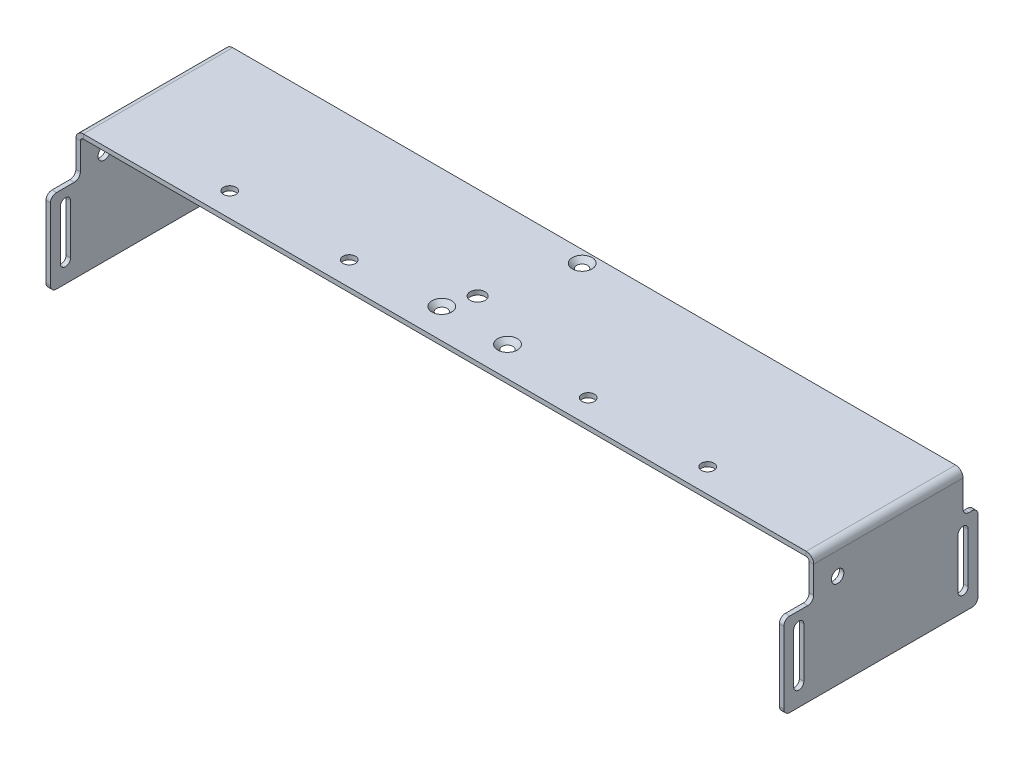
from build123d import *

# Parameters (mm, degrees)
SM_BASE_FLANGE_1_DEPTH       = 50
HOLE_WIZARD_1_AT_2_COUNT     = 2
HOLE_WIZARD_1_AT_2_PITCH     = 37.643060449
HOLE_WIZARD_1_AT_3_COUNT     = 2
HOLE_WIZARD_1_AT_3_PITCH     = 37.643060449
HOLE_WIZARD_4_2_4_2_1_D      = 4.2
HOLE_WIZARD_4_2_4_2_2_REACH  = 257.404
HOLE_WIZARD_4_2_4_2_2_BORE_R = 2.1
HOLE_WIZARD_5_0_5_1_D        = 5
SKETCH_18_W                  = 65
SKETCH_18_H                  = 28
SM_BASE_FLANGE_1_2_DEPTH     = 1.5
HOLE_START                   = -123.5
HOLE_WIZARD_3_4_3_4_2_DEPTH  = 1.5
FILLET_1_R                   = 2
FILLET_1_OF_MIRROR_2_R       = 2


# Read off the part's stored shape, not the designer's step: 基体-法兰1, Ø3.4 (3.4) 直径槽口2
# Sheet-metal steps are written as plain solids
with BuildPart() as part:
    # Sm Base Flange 1 outline → Sm Base Flange 1 (new body)
    with BuildSketch(Plane.XY):
        with BuildLine():
            Line((122, 39), (122, 0))
            Line((122, 0), (123.5, 0))
            Line((123.5, 0), (123.5, 39))
            ThreePointArc((123.5, 39), (122.767766953, 40.767766953), (121, 41.5))
            Line((121, 41.5), (-121, 41.5))
            ThreePointArc((-121, 41.5), (-122.767766953, 40.767766953), (-123.5, 39))
            Line((-123.5, 39), (-123.5, 0))
            Line((-123.5, 0), (-122, 0))
            Line((-122, 0), (-122, 39))
            ThreePointArc((-122, 39), (-121.707106781, 39.707106781), (-121, 40))
            Line((-121, 40), (121, 40))
            ThreePointArc((121, 40), (121.707106781, 39.707106781), (122, 39))
        make_face()
    extrude(amount=SM_BASE_FLANGE_1_DEPTH)

    # 草图9 → 打孔尺寸(%根据)开槽沉头木螺钉的类型1 (revolve, cut)
    with BuildSketch(Plane(origin=(0, 41.5, 4), x_dir=(0, 0, 1), z_dir=(1, 0, 0))):
        Polygon((0, 0), (0, 1.5), (1.7, 1.5), (1.7, 1.6), (3.3, 0), align=None)
    hole_wizard_1 = revolve(axis=Axis((0, 47.85, 4), (0, -1, 0)), mode=Mode.SUBTRACT)

    # 打孔尺寸(%根据)开槽沉头木螺钉的类型1 at 2: 打孔尺寸(%根据)开槽沉头木螺钉的类型1 ×2
    with Locations(*[Vector(-0.29221853559902017, 0, 0.956351571051339) * (i * HOLE_WIZARD_1_AT_2_PITCH) for i in range(1, HOLE_WIZARD_1_AT_2_COUNT)]):
        add(hole_wizard_1, mode=Mode.SUBTRACT)

    # 打孔尺寸(%根据)开槽沉头木螺钉的类型1 at 3: 打孔尺寸(%根据)开槽沉头木螺钉的类型1 ×2
    with Locations(*[Vector(0.2922185355990204, 0, 0.956351571051339) * (i * HOLE_WIZARD_1_AT_3_PITCH) for i in range(1, HOLE_WIZARD_1_AT_3_COUNT)]):
        add(hole_wizard_1, mode=Mode.SUBTRACT)

    # Ø4.2 (4.2) 直径孔1 (through all)
    with Locations(Plane(origin=(0, 41.5, 0), x_dir=(1, 0, 0), z_dir=(0, 1, 0))):
        with Locations((-40, -42), (-80, -42), (40, -42), (80, -42)):
            Hole(HOLE_WIZARD_4_2_4_2_1_D / 2)

    # Ø4.2 (4.2) 直径孔2 bore → Ø4.2 (4.2) 直径孔2 (cut, up to next)
    with BuildSketch(Plane(origin=(123.5, 0, 0), x_dir=(0, 0, -1), z_dir=(1, 0, 0)), mode=Mode.PRIVATE) as hole_wizard_4_2_4_2_2_sk1:
        with Locations((-42, 31.5)):
            Circle(HOLE_WIZARD_4_2_4_2_2_BORE_R)
    hole_wizard_4_2_4_2_2_tool1 = extrude(hole_wizard_4_2_4_2_2_sk1.sketch, amount=-HOLE_WIZARD_4_2_4_2_2_REACH, mode=Mode.PRIVATE) & part.part
    hole_wizard_4_2_4_2_2 = hole_wizard_4_2_4_2_2_tool1.solids().sort_by_distance((123.5, 31.5, 42))[0]
    add(hole_wizard_4_2_4_2_2, mode=Mode.SUBTRACT)

    # 镜向1: Ø4.2 (4.2) 直径孔2 across plane
    add(hole_wizard_4_2_4_2_2.mirror(Plane(origin=(0, 0, 0), x_dir=(0, 0, 1), z_dir=(1, 0, 0))), mode=Mode.SUBTRACT)

    # Ø5.0 (5) 直径孔1 (through all)
    with Locations(Plane(origin=(0, 41.5, 0), x_dir=(1, 0, 0), z_dir=(0, 1, 0))):
        with Locations((-8, -31)):
            Hole(HOLE_WIZARD_5_0_5_1_D / 2)

    # 草图18 → Sm Base Flange 1 2 (add)
    with BuildSketch(Plane.ZY.offset(123.5)):
        with Locations((27.5, 14)):
            Rectangle(SKETCH_18_W, SKETCH_18_H)
    sm_base_flange_1_2 = extrude(amount=-SM_BASE_FLANGE_1_2_DEPTH)

    # Ø3.4 (3.4) 直径槽口2 outline → Ø3.4 (3.4) 直径槽口2 (cut)
    with BuildSketch(Plane.YZ.offset(HOLE_START)):
        with BuildLine():
            ThreePointArc((23.3, 53.3), (25, 55), (23.3, 56.7))
            Line((23.3, 56.7), (6.7, 56.7))
            ThreePointArc((6.7, 56.7), (5, 55), (6.7, 53.3))
            Line((6.7, 53.3), (23.3, 53.3))
        make_face()
        with BuildLine():
            ThreePointArc((23.3, -1.7), (25, 0), (23.3, 1.7))
            Line((23.3, 1.7), (6.7, 1.7))
            ThreePointArc((6.7, 1.7), (5, 0), (6.7, -1.7))
            Line((6.7, -1.7), (23.3, -1.7))
        make_face()
    hole_wizard_3_4_3_4_2 = extrude(amount=HOLE_WIZARD_3_4_3_4_2_DEPTH, mode=Mode.SUBTRACT)

    # 圆角1
    fillet_1_edges = [part.edges().sort_by_distance(p)[0] for p in [
        (-122.75, 28, 0),
        (-122.75, 28, -5),
        (-122.75, 28, 60),
        (-122.75, 0, 60),
        (-122.75, 0, -5),
        (-122.75, 28, 50),
    ]]
    fillet(fillet_1_edges, radius=FILLET_1_R)

    # 镜向2: Sm Base Flange 1 2, Ø3.4 (3.4) 直径槽口2 across plane
    add(sm_base_flange_1_2.mirror(Plane(origin=(0, 0, 0), x_dir=(0, 0, 1), z_dir=(1, 0, 0))))
    add(hole_wizard_3_4_3_4_2.mirror(Plane(origin=(0, 0, 0), x_dir=(0, 0, 1), z_dir=(1, 0, 0))), mode=Mode.SUBTRACT)

    # 圆角1 of 镜向2
    fillet_1_of_mirror_2_edges = [part.edges().sort_by_distance(p)[0] for p in [
        (122.75, 28, 0),
        (122.75, 28, -5),
        (122.75, 28, 60),
        (122.75, 0, 60),
        (122.75, 0, -5),
        (122.75, 28, 50),
    ]]
    fillet(fillet_1_of_mirror_2_edges, radius=FILLET_1_OF_MIRROR_2_R)


solid = part.part
